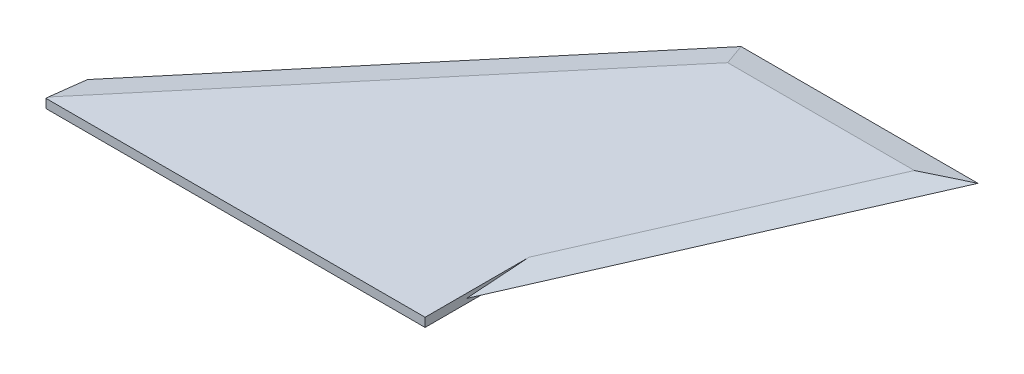
from build123d import *
from OCP.BRepFilletAPI import BRepFilletAPI_MakeChamfer

# Parameters (mm, degrees)
BOSS_EXTRUDE1_DEPTH = 2.3749
CHAMFER1_SIZE       = 2.3749
CHAMFER1_SIZE2      = 13.468727193
CHAMFER2_SIZE       = 2.3749
CHAMFER2_SIZE_2     = 13.468727193


with BuildPart() as part:
    # Sketch1 → Boss-Extrude1 (new, symmetric)
    with BuildSketch(Plane(origin=(0, 0, 0), x_dir=(1, 0, 0), z_dir=(0, 1, 0))):
        Polygon((-101.6, 0), (58.248479739, 190.5), (185.248479739, 190.5), (101.6, 0), (101.6, -22.225), (-101.6, -22.225), align=None)
    extrude(amount=BOSS_EXTRUDE1_DEPTH, both=True)

    # Chamfer1: one chamfer whose edges measure the first distance from different faces: ONE call of the kernel's chamfer builder (chamfer() names one face for all edges)
    chamfer1_edges_1 = [part.edges().sort_by_distance(p)[0] for p in [
        (121.748479739, 2.3749, -190.5),
    ]]
    chamfer1_side_1 = [part.faces().sort_by_distance(p)[0] for p in [
        (121.748479739, 0, -190.5),
    ]]
    chamfer1_edges_2 = [part.edges().sort_by_distance(p)[0] for p in [
        (-21.67576013, 2.3749, -95.25),
    ]]
    chamfer1_side_2 = [part.faces().sort_by_distance(p)[0] for p in [
        (-21.67576013, 0, -95.25),
    ]]
    chamfer1_edges_3 = [part.edges().sort_by_distance(p)[0] for p in [
        (143.42423987, 2.3749, -95.25),
    ]]
    chamfer1_side_3 = [part.faces().sort_by_distance(p)[0] for p in [
        (143.42423987, 0, -95.25),
    ]]
    chamfer1 = BRepFilletAPI_MakeChamfer(part.part.solid().wrapped)
    for e in chamfer1_edges_1:
        chamfer1.Add(CHAMFER1_SIZE, CHAMFER1_SIZE2, e.wrapped, chamfer1_side_1[0].wrapped)  # the first distance lies on this face
    for e in chamfer1_edges_2:
        chamfer1.Add(CHAMFER1_SIZE, CHAMFER1_SIZE2, e.wrapped, chamfer1_side_2[0].wrapped)  # the first distance lies on this face
    for e in chamfer1_edges_3:
        chamfer1.Add(CHAMFER1_SIZE, CHAMFER1_SIZE2, e.wrapped, chamfer1_side_3[0].wrapped)  # the first distance lies on this face
    add(Compound.cast(chamfer1.Shape()), mode=Mode.REPLACE)

    # Chamfer2
    # the kernel refuses this chamfer: 13.468727193, 2.3749 mm, written as the material it takes off along each edge
    with BuildSketch(Plane(origin=(199.319755492, -2.3749, -222.545747147), x_dir=(0.19240697277850308, 0.9776715712462557, 0.08448583078297824), z_dir=(-0.40204782056593685, 0, 0.9156186706146726))) as chamfer2_piece_1_section:
        Polygon((CHAMFER2_SIZE * 0.977671571246, CHAMFER2_SIZE * 0.210138760767), (-CHAMFER2_SIZE_2 * 0.210138760774, CHAMFER2_SIZE_2 * 0.977671571276), (0, 0), align=None)
    chamfer2_piece_1 = extrude(amount=278.054066026, mode=Mode.PRIVATE)
    chamfer2_piece_1 = split(chamfer2_piece_1, bisect_by=Plane(origin=(101.6, -1.721128259, -118.063928537), z_dir=(1, 0, 0)), keep=Keep.TOP, mode=Mode.PRIVATE)
    add(chamfer2_piece_1, mode=Mode.SUBTRACT)
    with BuildSketch(Plane(origin=(-124.096930076, -2.3749, 26.81079724), x_dir=(-0.1609756299698045, 0.9776715712462571, -0.13507459173619368), z_dir=(0.6427876096865406, 0, -0.7660444431189771))) as chamfer2_piece_2:
        Polygon((CHAMFER2_SIZE * 0.977671571246, CHAMFER2_SIZE * 0.210138760767), (-CHAMFER2_SIZE_2 * 0.210138760774, CHAMFER2_SIZE_2 * 0.977671571276), (0, 0), align=None)
    extrude(amount=318.678108919, mode=Mode.SUBTRACT)
    with BuildSketch(Plane(origin=(23.249469589, -2.3749, -190.5), x_dir=(0, 0.977671571246258, -0.21013876076743496), z_dir=(1, 0, 0))) as chamfer2_piece_3:
        Polygon((CHAMFER2_SIZE * 0.977671571246, CHAMFER2_SIZE * 0.210138760767), (-CHAMFER2_SIZE_2 * 0.210138760774, CHAMFER2_SIZE_2 * 0.977671571276), (0, 0), align=None)
    extrude(amount=196.998020301, mode=Mode.SUBTRACT)


solid = part.part
